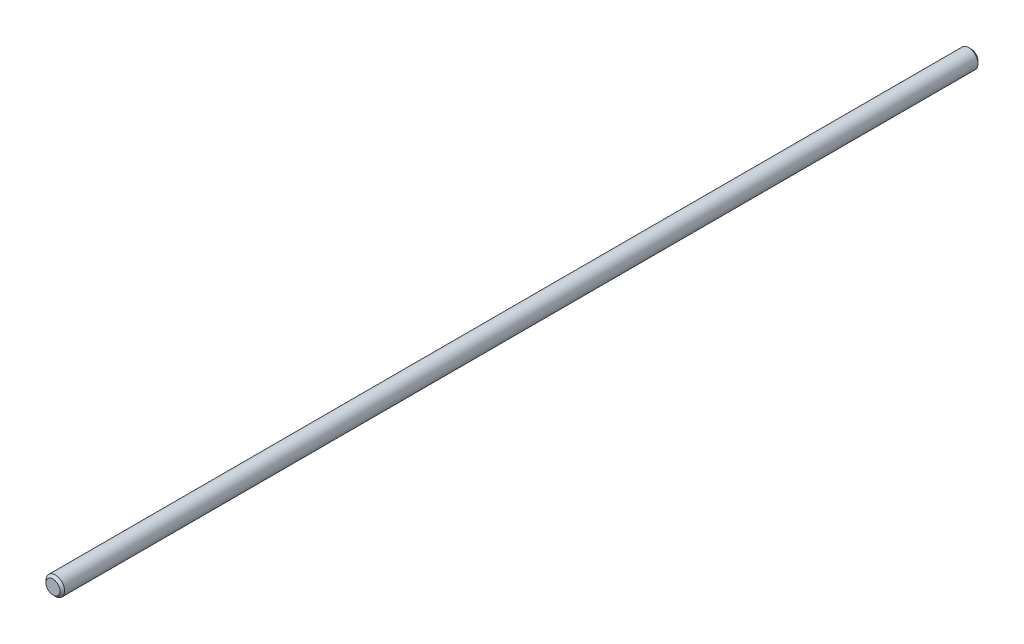
from build123d import *

# Parameters (mm, degrees)
SKETCH1_R           = 4
BOSS_EXTRUDE1_DEPTH = 395
CHAMFER1_SIZE       = 1


with BuildPart() as part:
    # Sketch1 → Boss-Extrude1 (new body)
    with BuildSketch(Plane.XY):
        Circle(SKETCH1_R)
    extrude(amount=BOSS_EXTRUDE1_DEPTH)

    # Chamfer1
    chamfer1_edges = [part.edges().sort_by_distance(p)[0] for p in [
        (-4, 0, 395),
        (-4, 0, 0),
    ]]
    chamfer(chamfer1_edges, length=CHAMFER1_SIZE)


solid = part.part
